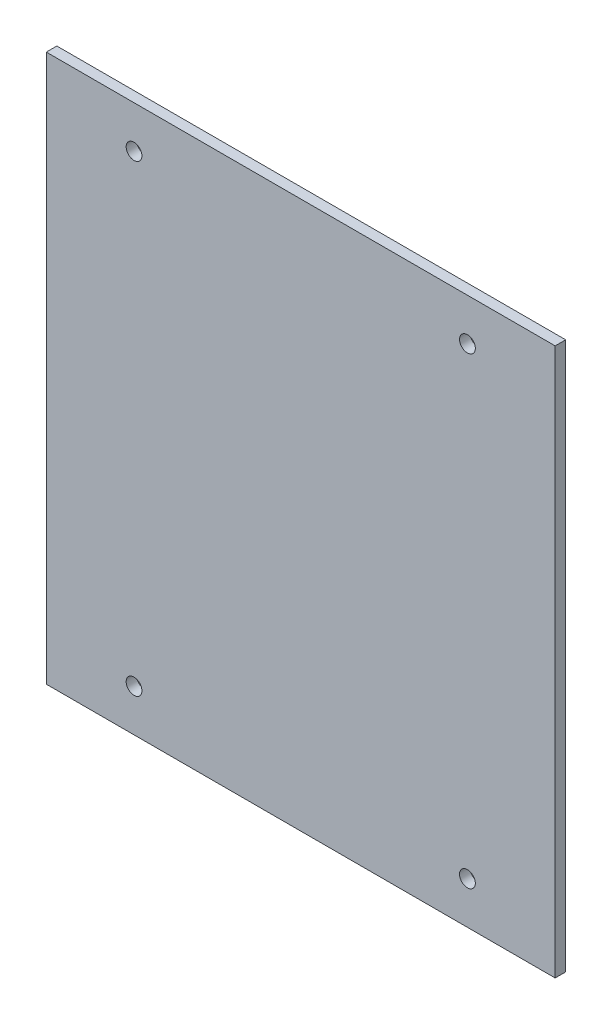
from build123d import *

# Parameters (mm, degrees)
SKIZZE1_W                       = 145
SKIZZE1_H                       = 156
AUFSATZ_LINEAR_AUSTRAGEN1_DEPTH = 3
DURCHGANGSLOCH_F_R_M41_D        = 4.5
DURCHGANGSLOCH_F_R_M41_DEPTH    = 3
DURCHGANGSLOCH_F_R_M41_TIP      = 1.351936393


with BuildPart() as part:
    # Skizze1 → Aufsatz-Linear austragen1 (new body)
    with BuildSketch(Plane.XY):
        Rectangle(SKIZZE1_W, SKIZZE1_H)
    extrude(amount=AUFSATZ_LINEAR_AUSTRAGEN1_DEPTH)

    # Durchgangsloch für M41
    with Locations(Plane.XY.offset(3)):
        with Locations((-47.5, -66), (47.5, -66), (47.5, 66), (-47.5, 66)):
            Hole(DURCHGANGSLOCH_F_R_M41_D / 2, depth=DURCHGANGSLOCH_F_R_M41_DEPTH)
            with Locations((0, 0, -(DURCHGANGSLOCH_F_R_M41_DEPTH + DURCHGANGSLOCH_F_R_M41_TIP / 2))):  # 118° drill point
                Cone(0, DURCHGANGSLOCH_F_R_M41_D / 2, DURCHGANGSLOCH_F_R_M41_TIP, mode=Mode.SUBTRACT)


solid = part.part
